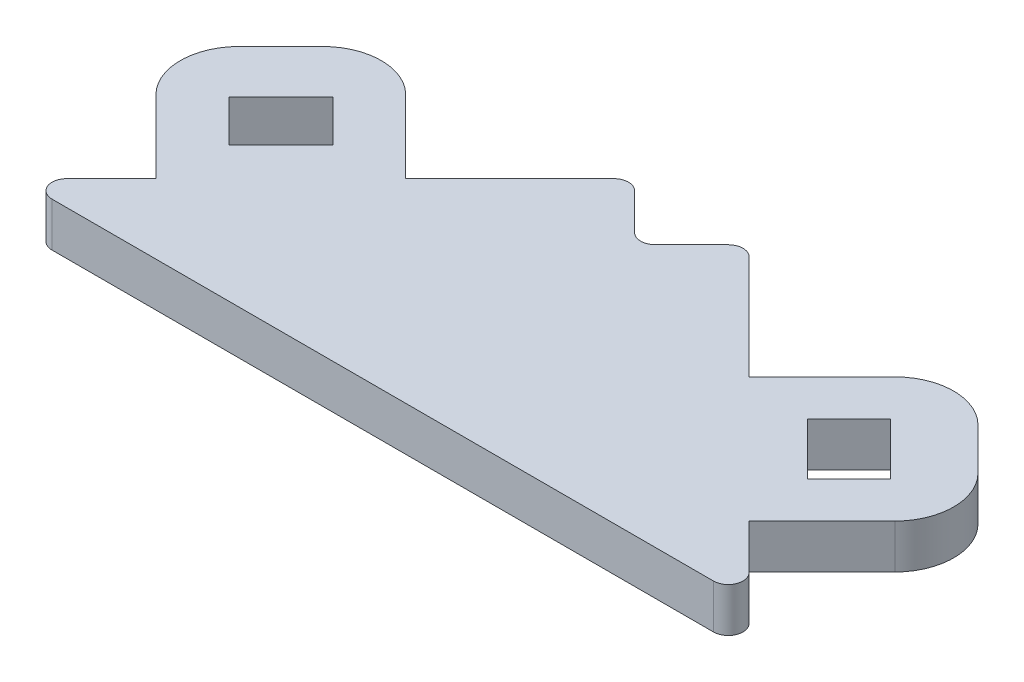
from build123d import *

# Parameters (mm, degrees)
BOSS_EXTRUDE1_DEPTH       = 19.05
SKETCH2_W                 = 25.4
SKETCH2_H                 = 31.75
SKETCH2_W_2               = 31.75
SKETCH2_H_2               = 25.4
CUT_EXTRUDE1_DEPTH        = 19.05
FILLET1_R                 = 25.4
FILLET2_R                 = 6.35
BODY_MOVE_COPY1_OUTLINE_W = 31.75
BODY_MOVE_COPY1_OUTLINE_H = 25.4
BODY_MOVE_COPY1_DEPTH     = 19.05
BODY_MOVE_COPY1_2_DEPTH   = 19.05


# Read off the part's stored shape, not the designer's step: Body-Move/Copy1
with BuildPart() as part:
    # Sketch1 → Boss-Extrude1 (new body)
    with BuildSketch(Plane(origin=(0, 0, 0), x_dir=(1, 0, 0), z_dir=(0, 1, 0))):
        Polygon((104.775, 223.510378542), (104.775, 293.360378542), (180.975, 293.360378542), (180.975, 223.510378542), (223.510378542, 223.510378542), (0, 0), (0, 42.535378542), (-69.85, 42.535378542), (-69.85, 118.735378542), (0, 118.735378542), (0, 188.585378542), (34.925, 188.585378542), (34.925, 223.510378542), align=None)
    extrude(amount=BOSS_EXTRUDE1_DEPTH)

    # Sketch2 → Cut-Extrude1 (cut)
    with BuildSketch(Plane(origin=(0, 19.05, 0), x_dir=(1, 0, 0), z_dir=(0, 1, 0))):
        with Locations((-30.48, 80.635378542)):
            Rectangle(SKETCH2_W, SKETCH2_H)
        with Locations((142.875, 253.990378542)):
            Rectangle(SKETCH2_W_2, SKETCH2_H_2)
    extrude(amount=-CUT_EXTRUDE1_DEPTH, mode=Mode.SUBTRACT)

    # Fillet1
    fillet1_edges = [part.edges().sort_by_distance(p)[0] for p in [
        (104.775, 9.525, -293.360378542),
        (180.975, 9.525, -293.360378542),
        (-69.85, 9.525, -42.535378542),
        (-69.85, 9.525, -118.735378542),
    ]]
    fillet(fillet1_edges, radius=FILLET1_R)

    # Fillet2
    fillet2_edges = [part.edges().sort_by_distance(p)[0] for p in [
        (223.510378542, 9.525, -223.510378542),
        (0, 9.525, 0),
        (0, 9.525, -188.585378542),
        (34.925, 9.525, -188.585378542),
        (34.925, 9.525, -223.510378542),
    ]]
    fillet(fillet2_edges, radius=FILLET2_R)

    # Body-Move/Copy1 outline → Body-Move/Copy1 (cut)
    # profile 1 of 2: a face of its own
    with BuildSketch(Plane(origin=(0, 0, 0), x_dir=(1, 0, 0), z_dir=(0, 1, 0))):
        with BuildLine():
            Line((122.509871939, 128.859871939), (125.684871939, 125.684871939))
            Line((125.684871939, 125.684871939), (212.670250482, 212.670250482))
            ThreePointArc((212.670250482, 212.670250482), (214.046757453, 219.590418338), (208.180122421, 223.510378542))
            Line((208.180122421, 223.510378542), (180.975, 223.510378542))
            Line((180.975, 223.510378542), (180.975, 267.960378542))
            ThreePointArc((180.975, 267.960378542), (173.535512243, 285.920890784), (155.575, 293.360378542))
            Line((155.575, 293.360378542), (130.175, 293.360378542))
            ThreePointArc((130.175, 293.360378542), (112.214487758, 285.920890784), (104.775, 267.960378542))
            Line((104.775, 267.960378542), (104.775, 223.510378542))
            Line((104.775, 223.510378542), (41.275, 223.510378542))
            ThreePointArc((41.275, 223.510378542), (36.784871939, 221.650506603), (34.925, 217.160378542))
            Line((34.925, 217.160378542), (34.925, 194.935378542))
            ThreePointArc((34.925, 194.935378542), (33.06512806, 190.445250481), (28.575, 188.585378542))
            Line((28.575, 188.585378542), (6.35, 188.585378542))
            ThreePointArc((6.35, 188.585378542), (1.859871939, 186.725506603), (0, 182.235378542))
            Line((0, 182.235378542), (0, 118.735378542))
            Line((0, 118.735378542), (-44.45, 118.735378542))
            ThreePointArc((-44.45, 118.735378542), (-62.410512242, 111.295890785), (-69.85, 93.335378542))
            Line((-69.85, 93.335378542), (-69.85, 67.935378542))
            ThreePointArc((-69.85, 67.935378542), (-62.410512242, 49.9748663), (-44.45, 42.535378542))
            Line((-44.45, 42.535378542), (0, 42.535378542))
            Line((0, 42.535378542), (0, 15.330256121))
            Line((0, 15.330256121), (14.746798487, 30.077054608))
            Line((14.746798487, 30.077054608), (-16.684097937, 61.507951031))
            ThreePointArc((-16.684097937, 61.507951031), (-18.126244186, 63.076488301), (-19.431850797, 64.760378542))
            Line((-19.431850797, 64.760378542), (-43.18, 64.760378542))
            Line((-43.18, 64.760378542), (-43.18, 96.510378542))
            Line((-43.18, 96.510378542), (-17.78, 96.510378542))
            Line((-17.78, 96.510378542), (-17.78, 96.261708161))
            ThreePointArc((-17.78, 96.261708161), (-17.241248642, 96.853979055), (-16.684097937, 97.428975516))
            Line((-16.684097937, 97.428975516), (1.276414305, 115.389487758))
            ThreePointArc((1.276414305, 115.389487758), (19.236926547, 122.828975516), (37.197438789, 115.389487758))
            Line((37.197438789, 115.389487758), (68.628335213, 83.958591334))
            Line((68.628335213, 83.958591334), (113.529615818, 128.859871939))
            ThreePointArc((113.529615818, 128.859871939), (118.019743879, 130.719743879), (122.509871939, 128.859871939))
        make_face()
        with Locations((142.875, 253.990378542)):
            Rectangle(BODY_MOVE_COPY1_OUTLINE_W, BODY_MOVE_COPY1_OUTLINE_H, mode=Mode.SUBTRACT)
    # profile 2 of 2: a face of its own
    with BuildSketch(Plane(origin=(0, 0, 0), x_dir=(1, 0, 0), z_dir=(0, 1, 0))):
        Polygon((40.340528432, 80.815501692), (22.38001619, 98.776013934), (-0.070624113, 76.325373631), (17.889888129, 58.364861389), align=None)
    extrude(amount=BODY_MOVE_COPY1_DEPTH, mode=Mode.SUBTRACT)

    # Body-Move_Copy1 2 outline → Body-Move_Copy1 2 (add)
    # profile 1 of 2: a face of its own
    with BuildSketch(Plane(origin=(0, 0, 0), x_dir=(1, 0, 0), z_dir=(0, 1, 0))):
        with BuildLine():
            Line((216.802561211, 83.958591334), (171.901280605, 128.859871939))
            ThreePointArc((171.901280605, 128.859871939), (167.411152544, 130.719743879), (162.921024484, 128.859871939))
            Line((162.921024484, 128.859871939), (147.205576272, 113.144423728))
            ThreePointArc((147.205576272, 113.144423728), (142.715448211, 111.284551788), (138.225320151, 113.144423728))
            Line((138.225320151, 113.144423728), (125.684871939, 125.684871939))
            Line((125.684871939, 125.684871939), (10.840128061, 10.840128061))
            ThreePointArc((10.840128061, 10.840128061), (3.919960205, 9.46362109), (0, 15.330256121))
            Line((0, 15.330256121), (-4.490128061, 10.840128061))
            ThreePointArc((-4.490128061, 10.840128061), (-5.866635031, 3.919960205), (0, 0))
            Line((0, 0), (285.430896424, 0))
            ThreePointArc((285.430896424, 0), (291.297531455, 3.919960205), (289.921024484, 10.840128061))
            Line((289.921024484, 10.840128061), (270.684097937, 30.077054608))
            Line((270.684097937, 30.077054608), (302.114994361, 61.507951031))
            ThreePointArc((302.114994361, 61.507951031), (309.554482119, 79.468463273), (302.114994361, 97.428975516))
            Line((302.114994361, 97.428975516), (284.154482119, 115.389487758))
            ThreePointArc((284.154482119, 115.389487758), (266.193969876, 122.828975516), (248.233457634, 115.389487758))
            Line((248.233457634, 115.389487758), (216.802561211, 83.958591334))
        make_face()
        Polygon((245.090367992, 80.815501692), (263.050880234, 98.776013934), (285.501520537, 76.325373631), (267.541008295, 58.364861389), align=None, mode=Mode.SUBTRACT)
    # profile 2 of 2: a face of its own
    with BuildSketch(Plane(origin=(0, 0, 0), x_dir=(1, 0, 0), z_dir=(0, 1, 0))):
        with BuildLine():
            ThreePointArc((-17.78, 96.261708161), (-24.088736474, 80.798548227), (-19.431850797, 64.760378542))
            Line((-19.431850797, 64.760378542), (-17.78, 64.760378542))
            Line((-17.78, 64.760378542), (-17.78, 96.261708161))
        make_face()
    extrude(amount=BODY_MOVE_COPY1_2_DEPTH)


solid = part.part
